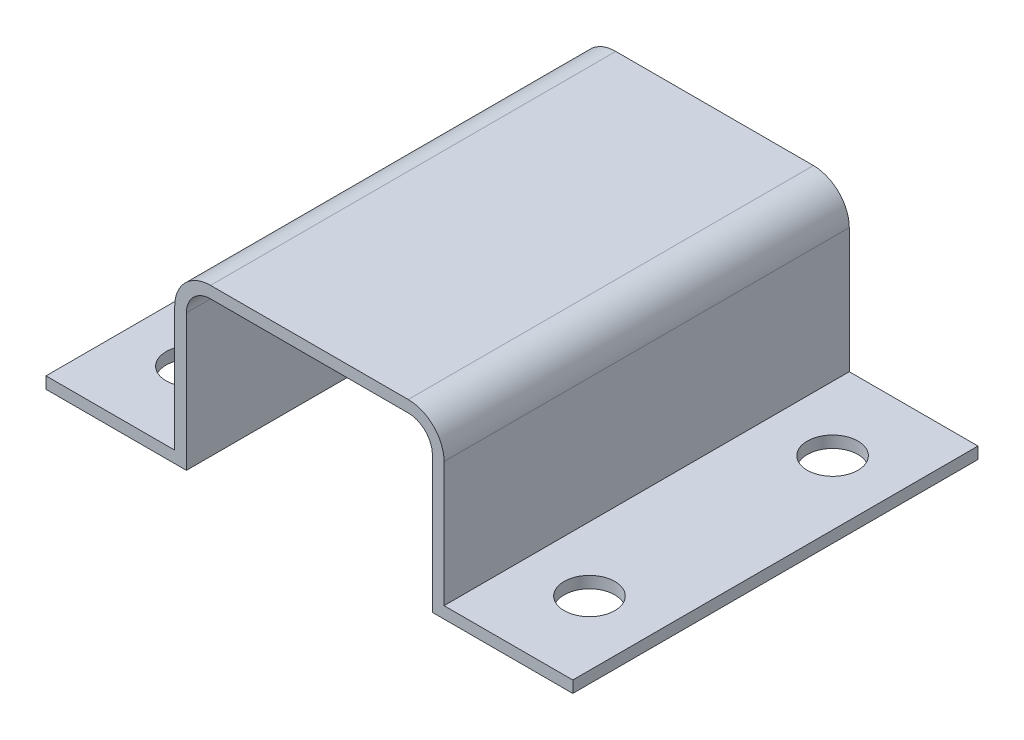
from build123d import *

# Parameters (mm, degrees)
BOSS_EXTRUDE3_DEPTH = 50.8
CUT_EXTRUDE1_REACH  = 87.717
SKETCH6_R           = 3.175


with BuildPart() as part:
    # Sketch5 → Boss-Extrude3 (new body)
    with BuildSketch(Plane.XY):
        with BuildLine():
            Line((0, 0), (17.6022, 0))
            Line((17.6022, 0), (17.6022, 17.110869124))
            ThreePointArc((17.6022, 17.110869124), (18.488776476, 19.251254076), (20.629161429, 20.137830552))
            Line((20.629161429, 20.137830552), (33.02, 20.137830552))
            Line((33.02, 20.137830552), (33.02, 21.602133449))
            Line((33.02, 21.602133449), (20.629161429, 21.602133449))
            ThreePointArc((20.629161429, 21.602133449), (17.453357968, 20.286672584), (16.137897104, 17.110869124))
            Line((16.137897104, 17.110869124), (16.137897104, 1.464302896))
            Line((16.137897104, 1.464302896), (0, 1.464302896))
            Line((0, 1.464302896), (0, 0))
        make_face()
    boss_extrude3 = extrude(amount=BOSS_EXTRUDE3_DEPTH)

    # Mirror6: Boss-Extrude3 across plane
    add(boss_extrude3.mirror(Plane(origin=(33.02, 21.602133449, 50.8), x_dir=(0, 0, 1), z_dir=(-1, 0, 0))))

    # Sketch6 → Cut-Extrude1 (cut, up to next)
    with BuildSketch(Plane(origin=(0, 1.464302896, 0), x_dir=(-1, 0, 0), z_dir=(0, 1, 0)), mode=Mode.PRIVATE) as cut_extrude1_sk1:
        with Locations((-8.068948552, 40.64)):
            Circle(SKETCH6_R)
    cut_extrude1_tool1 = extrude(cut_extrude1_sk1.sketch, amount=-CUT_EXTRUDE1_REACH, mode=Mode.PRIVATE) & part.part
    # Sketch6 → Cut-Extrude1 (cut, up to next)
    with BuildSketch(Plane(origin=(0, 1.464302896, 0), x_dir=(-1, 0, 0), z_dir=(0, 1, 0)), mode=Mode.PRIVATE) as cut_extrude1_sk2:
        with Locations((-8.068948552, 10.16)):
            Circle(SKETCH6_R)
    cut_extrude1_tool2 = extrude(cut_extrude1_sk2.sketch, amount=-CUT_EXTRUDE1_REACH, mode=Mode.PRIVATE) & part.part
    # Sketch6 → Cut-Extrude1 (cut, up to next)
    with BuildSketch(Plane(origin=(0, 1.464302896, 0), x_dir=(-1, 0, 0), z_dir=(0, 1, 0)), mode=Mode.PRIVATE) as cut_extrude1_sk3:
        with Locations((-57.971051448, 10.16)):
            Circle(SKETCH6_R)
    cut_extrude1_tool3 = extrude(cut_extrude1_sk3.sketch, amount=-CUT_EXTRUDE1_REACH, mode=Mode.PRIVATE) & part.part
    # Sketch6 → Cut-Extrude1 (cut, up to next)
    with BuildSketch(Plane(origin=(0, 1.464302896, 0), x_dir=(-1, 0, 0), z_dir=(0, 1, 0)), mode=Mode.PRIVATE) as cut_extrude1_sk4:
        with Locations((-57.971051448, 40.64)):
            Circle(SKETCH6_R)
    cut_extrude1_tool4 = extrude(cut_extrude1_sk4.sketch, amount=-CUT_EXTRUDE1_REACH, mode=Mode.PRIVATE) & part.part
    add(cut_extrude1_tool1.solids().sort_by_distance((8.068949, 1.464303, 40.64))[0], mode=Mode.SUBTRACT)
    add(cut_extrude1_tool2.solids().sort_by_distance((8.068949, 1.464303, 10.16))[0], mode=Mode.SUBTRACT)
    add(cut_extrude1_tool3.solids().sort_by_distance((57.971051, 1.464303, 10.16))[0], mode=Mode.SUBTRACT)
    add(cut_extrude1_tool4.solids().sort_by_distance((57.971051, 1.464303, 40.64))[0], mode=Mode.SUBTRACT)


solid = part.part
